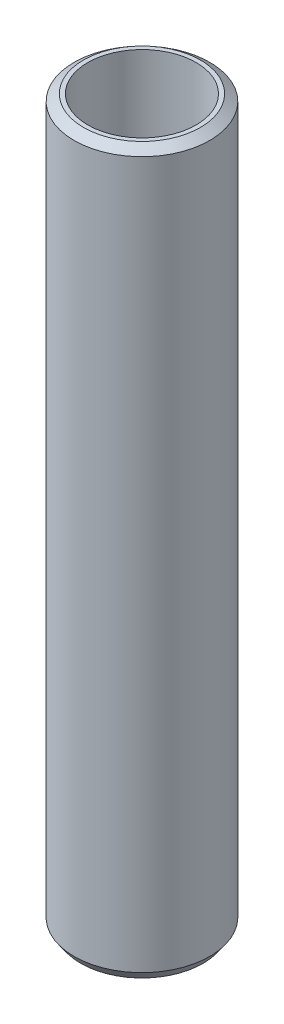
from build123d import *
from OCP.BRepFilletAPI import BRepFilletAPI_MakeChamfer

# Parameters (mm, degrees)
SKETCH1_R           = 50
BOSS_EXTRUDE1_DEPTH = 532.977793774
SKETCH2_R           = 39.943156089
CUT_EXTRUDE1_DEPTH  = 538.647959781
CHAMFER1_SIZE       = 4.882988459
CHAMFER1_SIZE2      = 6.87558454


with BuildPart() as part:
    # Sketch1 → Boss-Extrude1 (new body)
    with BuildSketch(Plane(origin=(0, 0, 0), x_dir=(1, 0, 0), z_dir=(0, 1, 0))):
        Circle(SKETCH1_R)
    extrude(amount=BOSS_EXTRUDE1_DEPTH)

    # Sketch2 → Cut-Extrude1 (cut, through all)
    with BuildSketch(Plane(origin=(0, 0, 0), x_dir=(1, 0, 0), z_dir=(0, 1, 0))):
        Circle(SKETCH2_R)
    extrude(amount=CUT_EXTRUDE1_DEPTH, mode=Mode.SUBTRACT)

    # Chamfer1: one chamfer whose edges measure the first distance from different faces: ONE call of the kernel's chamfer builder (chamfer() names one face for all edges)
    chamfer1_edges_1 = [part.edges().sort_by_distance(p)[0] for p in [
        (-50, 532.977793774, 0),
    ]]
    chamfer1_side_1 = [part.faces().sort_by_distance(p)[0] for p in [
        (-50, 266.488896887, 0),
    ]]
    chamfer1_edges_2 = [part.edges().sort_by_distance(p)[0] for p in [
        (-50, 0, 0),
    ]]
    chamfer1_side_2 = [part.faces().sort_by_distance(p)[0] for p in [
        (-48.585786438, 0, 0),
    ]]
    chamfer1 = BRepFilletAPI_MakeChamfer(part.part.solid().wrapped)
    for e in chamfer1_edges_1:
        chamfer1.Add(CHAMFER1_SIZE, CHAMFER1_SIZE2, e.wrapped, chamfer1_side_1[0].wrapped)  # the first distance lies on this face
    for e in chamfer1_edges_2:
        chamfer1.Add(CHAMFER1_SIZE, CHAMFER1_SIZE2, e.wrapped, chamfer1_side_2[0].wrapped)  # the first distance lies on this face
    add(Compound.cast(chamfer1.Shape()), mode=Mode.REPLACE)


solid = part.part
